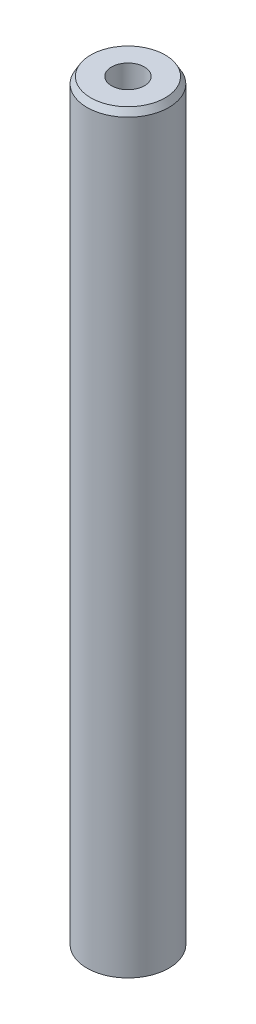
from build123d import *
from OCP.BRepFilletAPI import BRepFilletAPI_MakeChamfer

# Parameters (mm, degrees)
SKETCH1_R           = 32.5
BOSS_EXTRUDE1_DEPTH = 600
SKETCH2_R           = 13.024786055
CUT_EXTRUDE1_DEPTH  = 602.757841661
CHAMFER1_SIZE       = 5.138461338
CHAMFER1_SIZE2      = 2.966692037


with BuildPart() as part:
    # Sketch1 → Boss-Extrude1 (new body)
    with BuildSketch(Plane(origin=(0, 0, 0), x_dir=(1, 0, 0), z_dir=(0, 1, 0))):
        Circle(SKETCH1_R)
    extrude(amount=BOSS_EXTRUDE1_DEPTH)

    # Sketch2 → Cut-Extrude1 (cut, through all)
    with BuildSketch(Plane(origin=(0, 0, 0), x_dir=(1, 0, 0), z_dir=(0, 1, 0))):
        Circle(SKETCH2_R)
    extrude(amount=CUT_EXTRUDE1_DEPTH, mode=Mode.SUBTRACT)

    # Chamfer1: one chamfer whose edges measure the first distance from different faces: ONE call of the kernel's chamfer builder (chamfer() names one face for all edges)
    chamfer1_edges_1 = [part.edges().sort_by_distance(p)[0] for p in [
        (-32.5, 600, 0),
    ]]
    chamfer1_side_1 = [part.faces().sort_by_distance(p)[0] for p in [
        (-32.5, 300, 0),
    ]]
    chamfer1_edges_2 = [part.edges().sort_by_distance(p)[0] for p in [
        (-32.5, 0, 0),
    ]]
    chamfer1_side_2 = [part.faces().sort_by_distance(p)[0] for p in [
        (-31.580761184, 0, 0),
    ]]
    chamfer1 = BRepFilletAPI_MakeChamfer(part.part.solid().wrapped)
    for e in chamfer1_edges_1:
        chamfer1.Add(CHAMFER1_SIZE, CHAMFER1_SIZE2, e.wrapped, chamfer1_side_1[0].wrapped)  # the first distance lies on this face
    for e in chamfer1_edges_2:
        chamfer1.Add(CHAMFER1_SIZE, CHAMFER1_SIZE2, e.wrapped, chamfer1_side_2[0].wrapped)  # the first distance lies on this face
    add(Compound.cast(chamfer1.Shape()), mode=Mode.REPLACE)


solid = part.part
